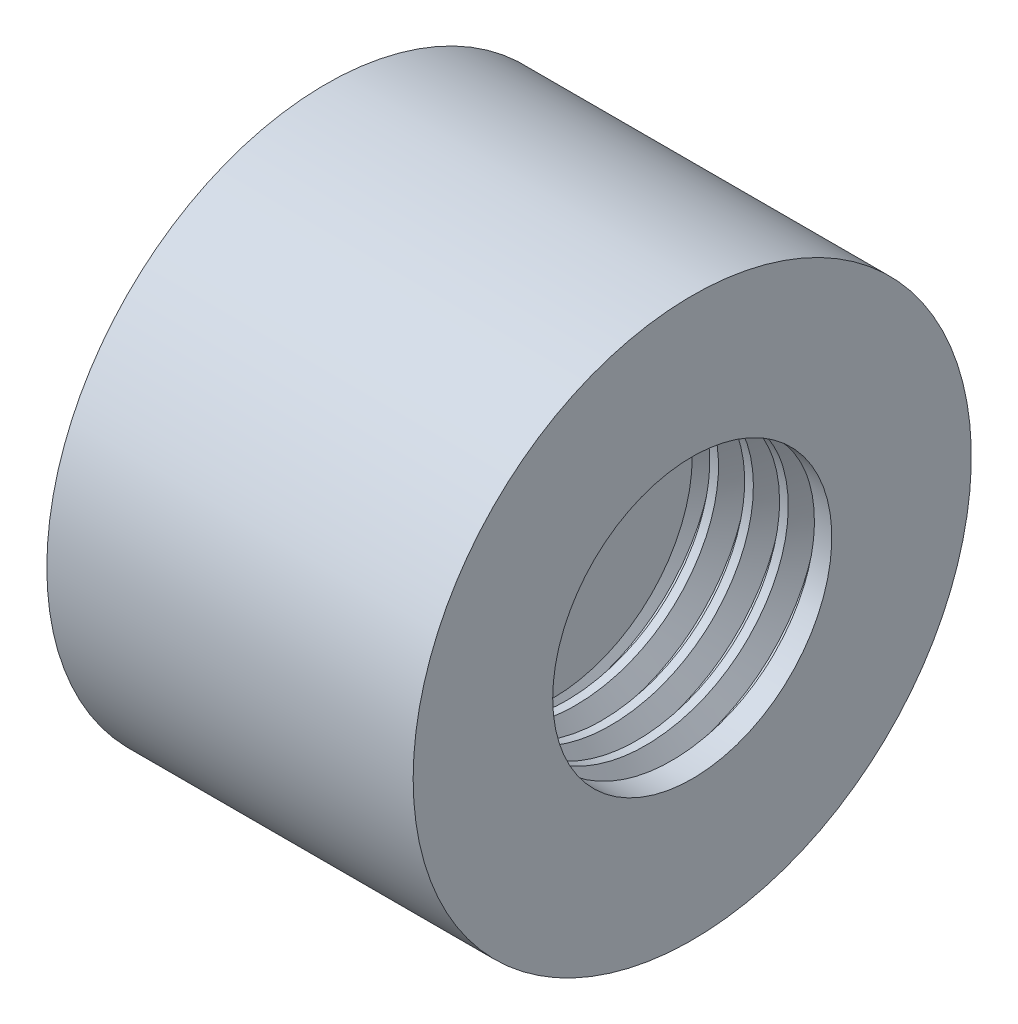
from build123d import *
from build123d.topology import SkipClean

# Parameters (mm, degrees)
IZIM1_W               = 10.5
IZIM1_H               = 8
IZIM3_R               = 4
KES_EKSTR_ZYON1_DEPTH = 4
DI_1_PITCH            = 1


with BuildPart() as part:
    # Çizim1 → Döndür1 (revolve)
    with BuildSketch(Plane.XY, mode=Mode.PRIVATE) as d_nd_r1_sk:
        with Locations((-0.900163094, -2.913793103)):
            Rectangle(IZIM1_W, IZIM1_H)
    revolve(d_nd_r1_sk.sketch.rotate(Axis((-6.150163094, 1.086206897, 0), (1, 0, 0)), 270), axis=Axis((-6.150163094, 1.086206897, 0), (1, 0, 0)))

    # Çizim3 → Kes-Ekstrüzyon1 (cut)
    with BuildSketch(Plane(origin=(4.349836906, 0, 0), x_dir=(0, 0, -1), z_dir=(1, 0, 0))):
        with Locations((0, 1.086206897)):
            Circle(IZIM3_R)
    extrude(amount=-KES_EKSTR_ZYON1_DEPTH, mode=Mode.SUBTRACT)

    # Diş1: the profile of Diş Profili1 profile screwed along a right-hand helix of 4.5 turns, 8 arcs to a turn; built about Z, then put on its axis
    with SkipClean():  # the faces are left unmerged after this step: merging them gives an invalid solid
        di_1_z = Axis((0, 0, 0), (0, 0, 1))
        di_1_corners = [(3.9997, 0, -0.000173205), (4.541265875, 0, 0.312499999), (4.541265875, 0, 0.437499999), (3.9997, 0, 0.750173202)]
        with BuildLine(mode=Mode.PRIVATE) as di_1_profile:
            Line(di_1_corners[0], di_1_corners[1])
            Line(di_1_corners[1], di_1_corners[2])
            Line(di_1_corners[2], di_1_corners[3])
            Line(di_1_corners[3], di_1_corners[0])
        di_1_cap = Face(di_1_profile.wire())
        di_1_turn_angles = [0, 22.5, 45, 67.5, 90, 112.5, 135, 157.5, 180, 202.5, 225, 247.5, 270, 292.5, 315, 337.5, 360]
        di_1_turn_weights = [1, 0.9238795325112867, 1, 0.9238795325112867, 1, 0.9238795325112867, 1, 0.9238795325112867, 1, 0.9238795325112867, 1, 0.9238795325112867, 1, 0.9238795325112867, 1, 0.9238795325112867, 1]
        di_1_turn_rails = [Edge.make_bspline([Vector(p[0], p[1], 0).rotate(di_1_z, di_1_turn_angles[k]) / di_1_turn_weights[k] + Vector(0, 0, p[2] + DI_1_PITCH * di_1_turn_angles[k] / 360) for k in range(17)], [0, 0, 0, 1, 1, 2, 2, 3, 3, 4, 4, 5, 5, 6, 6, 7, 7, 8, 8, 8], 2, di_1_turn_weights) for p in di_1_corners]
        di_1_turn_sides = [Face.make_surface_from_curves(di_1_turn_rails[p[0]], di_1_turn_rails[p[1]]) for p in [(0, 1), (1, 2), (2, 3), (3, 0)]]
        di_1_last_angles = [1440, 1462.5, 1485, 1507.5, 1530, 1552.5, 1575, 1597.5, 1620]
        di_1_last_weights = [1, 0.9238795325112867, 1, 0.9238795325112867, 1, 0.9238795325112867, 1, 0.9238795325112867, 1]
        di_1_last_rails = [Edge.make_bspline([Vector(p[0], p[1], 0).rotate(di_1_z, di_1_last_angles[k]) / di_1_last_weights[k] + Vector(0, 0, p[2] + DI_1_PITCH * di_1_last_angles[k] / 360) for k in range(9)], [0, 0, 0, 1, 1, 2, 2, 3, 3, 4, 4, 4], 2, di_1_last_weights) for p in di_1_corners]
        di_1_last_sides = [Face.make_surface_from_curves(di_1_last_rails[p[0]], di_1_last_rails[p[1]]) for p in [(0, 1), (1, 2), (2, 3), (3, 0)]]
        di_1 = Plane(origin=(4.349836906, 1.086206897, 0), x_dir=(0, 0, 1), z_dir=(-1, 0, 0)) * Solid(Shell([*[p.moved(Location((0, 0, DI_1_PITCH * i))) for i in range(4) for p in di_1_turn_sides], *di_1_last_sides, di_1_cap, di_1_cap.rotate(di_1_z, 1620).moved(Location((0, 0, DI_1_PITCH * 1620 / 360)))]))
        add(di_1, mode=Mode.SUBTRACT)


solid = part.part
